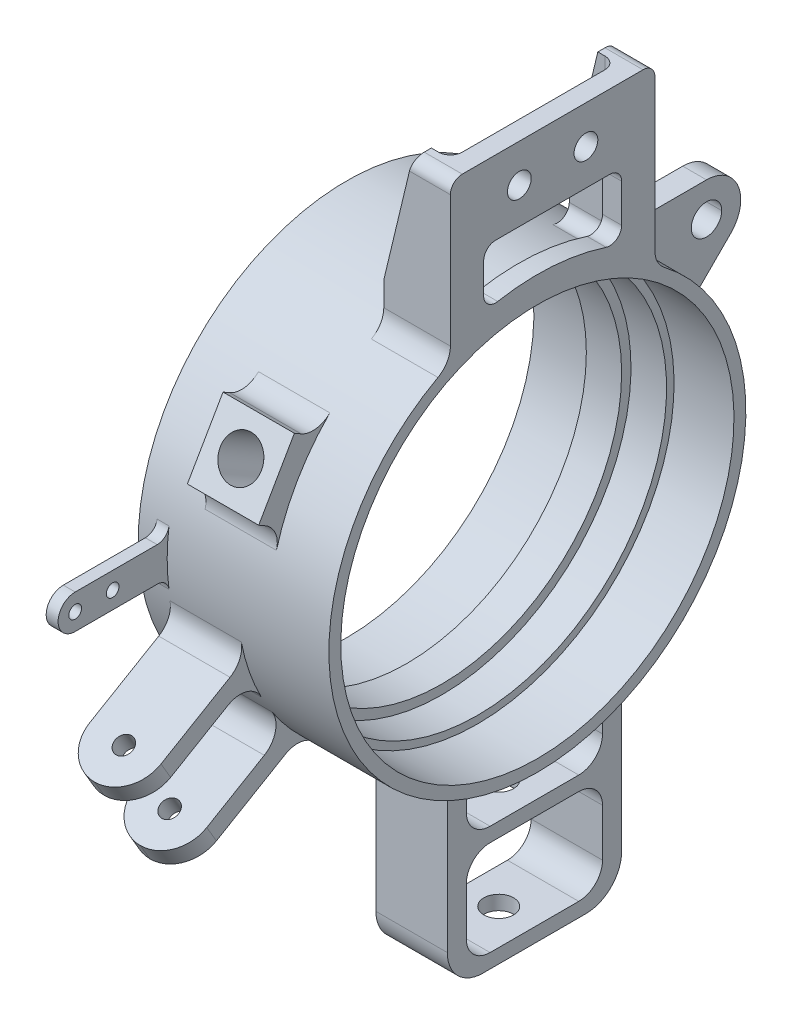
from build123d import *

# Parameters (mm, degrees)
BOSS_EXTRUDE2_DEPTH                  = 37.035000098
BOSS_EXTRUDE2_DIRECTION_2_REACH      = 136.506
BOSS_EXTRUDE2_DIRECTION_2_END_RADIUS = 55.675
SKETCH10_R                           = 4.064
BOSS_EXTRUDE5_DEPTH                  = 6.35
SKETCH12_R                           = 3.175
CUT_EXTRUDE5_DEPTH                   = 129.924460147
BOSS_EXTRUDE7_DEPTH                  = 9.525
BOSS_EXTRUDE7_DEPTH_BACK             = 9.525
CUT_EXTRUDE7_REACH                   = 164.311
SKETCH19_R                           = 5.5
BOSS_EXTRUDE10_REACH                 = 175.333
BOSS_EXTRUDE10_END_RADIUS            = 55.675
SKETCH24_W                           = 19.05
SKETCH24_H                           = 46.533000914
BOSS_EXTRUDE10_DIRECTION_2_DEPTH     = 53.34
CUT_EXTRUDE12_REACH                  = 138.628
SKETCH29_W                           = 36.373000914
SKETCH29_H                           = 25.4
CUT_EXTRUDE11_REACH                  = 222.725
SKETCH26_R                           = 3.96875
CUT_EXTRUDE13_DEPTH                  = 155.515038009
CUT_EXTRUDE14_REACH                  = 143.105
SKETCH32_R                           = 1.7
BOSS_EXTRUDE11_DEPTH                 = 3.175
BOSS_EXTRUDE12_DEPTH                 = 9.525
BOSS_EXTRUDE12_DEPTH_BACK            = 9.525
CUT_EXTRUDE15_REACH                  = 156.791
SKETCH35_R                           = 2.38125
F_0_125_FILLETS_R                    = 3.175
F_0_375_FILLETS_R                    = 9.525
FILLET1_R                            = 6.35


with BuildPart() as part:
    # Sketch1 → Revolve1 (revolve)
    with BuildSketch(Plane.XY, mode=Mode.PRIVATE) as revolve1_sk:
        Polygon((50.925, 52.5), (34.925, 52.5), (34.925, 50.5), (25.425, 50.5), (25.425, 48), (16, 48), (16, 50), (0, 50), (0, 55.675), (50.925, 55.675), align=None)
    revolve(revolve1_sk.sketch.rotate(Axis((50.925, 0, 0), (-1, 0, 0)), 180), axis=Axis((50.925, 0, 0), (-1, 0, 0)))

    # Sketch4 → Boss-Extrude2 (add)
    with BuildSketch(Plane(origin=(0, 55.675, 0), x_dir=(1, 0, 0), z_dir=(0, 1, 0))):
        Polygon((45.845, 26.299476992), (45.845, -18.150523008), (33.145, -18.150523008), (33.145, -23.230523008), (50.925, -23.230523008), (50.925, 31.379476992), (33.145, 31.379476992), (33.145, 26.299476992), align=None)
    extrude(amount=BOSS_EXTRUDE2_DEPTH)

    # Boss-Extrude2 direction 2: up to this cylinder (the profile starts outside it)
    boss_extrude2_direction_2_end = Plane(origin=(46.419315, 0, 0), z_dir=(-1, 0, 0)) * Cylinder(BOSS_EXTRUDE2_DIRECTION_2_END_RADIUS, 385.362, mode=Mode.PRIVATE)
    # Sketch4 → Boss-Extrude2 direction 2 (add, up to the surface)
    with BuildSketch(Plane(origin=(0, 55.675, 0), x_dir=(1, 0, 0), z_dir=(0, 1, 0)), mode=Mode.PRIVATE) as boss_extrude2_direction_2_sk1:
        Polygon((45.845, 26.299476992), (45.845, -18.150523008), (33.145, -18.150523008), (33.145, -23.230523008), (50.925, -23.230523008), (50.925, 31.379476992), (33.145, 31.379476992), (33.145, 26.299476992), align=None)
    boss_extrude2_direction_2_tool1 = extrude(boss_extrude2_direction_2_sk1.sketch, amount=-BOSS_EXTRUDE2_DIRECTION_2_REACH, mode=Mode.PRIVATE) - boss_extrude2_direction_2_end
    add(boss_extrude2_direction_2_tool1.solids().sort_by_distance((46.419315, 55.675, -4.074477))[0])
    add(boss_extrude2_direction_2_tool1.solids().sort_by_distance((46.419315, 55.675, -4.074477))[1])

    # Sketch10 → Boss-Extrude5 (add)
    # profile 1 of 2: a face of its own
    with BuildSketch(Plane.ZY.offset(-31.5204)):
        with BuildLine():
            Line((-64.565, 39.37), (-39.36634, 39.37))
            ThreePointArc((-39.36634, 39.37), (-49.811855399, 24.869352358), (-55.12501584, 7.806295771))
            Line((-55.12501584, 7.806295771), (-71.040546107, 23.769992053))
            ThreePointArc((-71.040546107, 23.769992053), (-73.01030854, 33.731638268), (-64.565, 39.37))
        make_face()
        with Locations((-64.565, 30.226)):
            Circle(SKETCH10_R, mode=Mode.SUBTRACT)
    # profile 2 of 2: a face of its own
    with BuildSketch(Plane.ZY.offset(-31.5204)):
        with BuildLine():
            Line((-62.9635572, -39.228672767), (-42.774784878, -35.637387722))
            ThreePointArc((-42.774784878, -35.637387722), (-50.889440604, -22.582525547), (-55.12501584, -7.806295771))
            Line((-55.12501584, -7.806295771), (-71.040546107, -23.769992053))
            ThreePointArc((-71.040546107, -23.769992053), (-72.669438483, -34.460479056), (-62.9635572, -39.228672767))
        make_face()
        with Locations((-64.565, -30.226)):
            Circle(SKETCH10_R, mode=Mode.SUBTRACT)
    extrude(amount=BOSS_EXTRUDE5_DEPTH)

    # Sketch12 → Cut-Extrude5 (cut, through all)
    with BuildSketch(Plane(origin=(50.925, 0, 0), x_dir=(0, 0, -1), z_dir=(1, 0, 0))):
        with Locations((-4.815523008, 82.550000098)):
            Circle(SKETCH12_R)
        with Locations((12.964476992, 82.550000098)):
            Circle(SKETCH12_R)
    extrude(amount=-CUT_EXTRUDE5_DEPTH, mode=Mode.SUBTRACT)

    # Sketch18 → Boss-Extrude7 (add, two sides: drawn at the far end of the back side and taken through both)
    with BuildSketch(Plane.ZY.offset(-25.4625).offset(-BOSS_EXTRUDE7_DEPTH_BACK)):
        with BuildLine():
            Line((48.95272567, 39.261391971), (58.47772567, 22.763608029))
            Line((58.47772567, 22.763608029), (52.267604989, 19.178193182))
            ThreePointArc((52.267604989, 19.178193182), (48.215964356, 27.8375), (42.742604989, 35.675977124))
            Line((42.742604989, 35.675977124), (48.95272567, 39.261391971))
        make_face()
    extrude(amount=BOSS_EXTRUDE7_DEPTH + BOSS_EXTRUDE7_DEPTH_BACK)

    # Sketch19 → Cut-Extrude7 (cut, up to next)
    with BuildSketch(Plane(origin=(0, 31.0125, 53.71522567), x_dir=(1, 0, 0), z_dir=(0, 0.5000000000000013, 0.8660254037844379)), mode=Mode.PRIVATE) as cut_extrude7_sk1:
        with Locations(Location((25.4625, 0, 0), (0, 0, 270))):
            Circle(SKETCH19_R)
    cut_extrude7_tool1 = extrude(cut_extrude7_sk1.sketch, amount=-CUT_EXTRUDE7_REACH, mode=Mode.PRIVATE) & part.part
    add(cut_extrude7_tool1.solids().sort_by_distance((25.4625, 31.0125, 53.715226))[0], mode=Mode.SUBTRACT)

    # Boss-Extrude10: up to this cylinder (the profile starts outside it)
    boss_extrude10_end = Plane(origin=(27.217303, 0, 0), z_dir=(-1, 0, 0)) * Cylinder(BOSS_EXTRUDE10_END_RADIUS, 463.016, mode=Mode.PRIVATE)
    # Sketch24 → Boss-Extrude10 (add, up to the surface)
    with BuildSketch(Plane(origin=(0, -55.675, 0), x_dir=(-1, 0, 0), z_dir=(0, -1, 0)), mode=Mode.PRIVATE) as boss_extrude10_sk1:
        with Locations((-27.217302944, 13.392580276)):
            Rectangle(SKETCH24_W, SKETCH24_H)
    boss_extrude10_tool1 = extrude(boss_extrude10_sk1.sketch, amount=-BOSS_EXTRUDE10_REACH, mode=Mode.PRIVATE) - boss_extrude10_end
    add(boss_extrude10_tool1.solids().sort_by_distance((27.217303, -55.675, -13.39258))[0])
    add(boss_extrude10_tool1.solids().sort_by_distance((27.217303, -55.675, -13.39258))[1])

    # Sketch24 → Boss-Extrude10 direction 2 (add)
    with BuildSketch(Plane(origin=(0, -55.675, 0), x_dir=(-1, 0, 0), z_dir=(0, -1, 0))):
        with Locations((-27.217302944, 13.392580276)):
            Rectangle(SKETCH24_W, SKETCH24_H)
    extrude(amount=BOSS_EXTRUDE10_DIRECTION_2_DEPTH)

    # Sketch29 → Cut-Extrude12 (cut, up to next)
    with BuildSketch(Plane(origin=(36.742302944, 0, 0), x_dir=(0, 0, -1), z_dir=(1, 0, 0)), mode=Mode.PRIVATE) as cut_extrude12_sk1:
        with Locations((13.392580276, -92.505)):
            Rectangle(SKETCH29_W, SKETCH29_H)
    cut_extrude12_tool1 = extrude(cut_extrude12_sk1.sketch, amount=-CUT_EXTRUDE12_REACH, mode=Mode.PRIVATE) & part.part
    # Sketch29 → Cut-Extrude12 (cut, up to next)
    with BuildSketch(Plane(origin=(36.742302944, 0, 0), x_dir=(0, 0, -1), z_dir=(1, 0, 0)), mode=Mode.PRIVATE) as cut_extrude12_sk2:
        with BuildLine():
            Line((-4.793920181, -58.654418668), (-4.793920181, -75.995))
            Line((-4.793920181, -75.995), (31.579080733, -75.995))
            Line((31.579080733, -75.995), (31.579080733, -49.659683447))
            ThreePointArc((31.579080733, -49.659683447), (14.127544793, -57.129107976), (-4.793920181, -58.654418668))
        make_face()
    cut_extrude12_tool2 = extrude(cut_extrude12_sk2.sketch, amount=-CUT_EXTRUDE12_REACH, mode=Mode.PRIVATE) & part.part
    add(cut_extrude12_tool1.solids().sort_by_distance((36.742303, -92.505, -13.39258))[0], mode=Mode.SUBTRACT)
    add(cut_extrude12_tool2.solids().sort_by_distance((36.742303, -65.94755, -14.743254))[0], mode=Mode.SUBTRACT)

    # Cut-Extrude11: up to this face of the body (flat: up to its plane)
    cut_extrude11_end = Plane(part.part.faces().sort_by_distance((27.217302944, -75.995, -13.392580276))[0])
    # Sketch26 → Cut-Extrude11 (cut, up to the picked face)
    with BuildSketch(Plane.XZ.offset(109.015), mode=Mode.PRIVATE) as cut_extrude11_sk1:
        with Locations(Location((27.217302944, -13.392580276, 0), (0, 0, 270))):
            Circle(SKETCH26_R)
    cut_extrude11_tool1 = split(extrude(cut_extrude11_sk1.sketch, amount=-CUT_EXTRUDE11_REACH, mode=Mode.PRIVATE), bisect_by=cut_extrude11_end, keep=Keep.BOTH, mode=Mode.PRIVATE)
    add(cut_extrude11_tool1.solids().sort_by(Axis((27.217303, -109.015, -13.39258), (0, 1, 0)))[0], mode=Mode.SUBTRACT)

    # Sketch30 → Cut-Extrude13 (cut, through all)
    with BuildSketch(Plane.XY.offset(23.230523008)):
        Polygon((33.145, 92.710000098), (33.145, 60.960000098), (40.765, 92.710000098), align=None)
    extrude(amount=-CUT_EXTRUDE13_DEPTH, mode=Mode.SUBTRACT)

    # Sketch21 → Cut-Extrude14 (cut, up to next)
    with BuildSketch(Plane(origin=(50.925, 0, 0), x_dir=(0, 0, -1), z_dir=(1, 0, 0)), mode=Mode.PRIVATE) as cut_extrude14_sk1:
        with BuildLine():
            Line((-14.340523008, 61.657170678), (-14.340523008, 69.795534597))
            ThreePointArc((-14.340523008, 69.795534597), (-13.410587038, 72.040598627), (-11.165523008, 72.970534597))
            Line((-11.165523008, 72.970534597), (19.314476992, 72.970534597))
            ThreePointArc((19.314476992, 72.970534597), (21.559541022, 72.040598627), (22.489476992, 69.795534597))
            Line((22.489476992, 69.795534597), (22.489476992, 59.608947135))
            ThreePointArc((22.489476992, 59.608947135), (21.181740717, 57.041078139), (18.335806956, 56.58854485))
            ThreePointArc((18.335806956, 56.58854485), (3.988333746, 59.351145052), (-10.599762785, 58.532984324))
            ThreePointArc((-10.599762785, 58.532984324), (-13.200754726, 59.220275757), (-14.340523008, 61.657170678))
        make_face()
    cut_extrude14_tool1 = extrude(cut_extrude14_sk1.sketch, amount=-CUT_EXTRUDE14_REACH, mode=Mode.PRIVATE) & part.part
    add(cut_extrude14_tool1.solids().sort_by_distance((50.925, 65.695583, -4.596287))[0], mode=Mode.SUBTRACT)

    # Sketch32 → Boss-Extrude11 (add)
    with BuildSketch(Plane(origin=(7.745, 0, 0), x_dir=(0, 0, -1), z_dir=(1, 0, 0))):
        with BuildLine():
            Line((-80.233, -4.572), (-55.486957395, -4.572))
            ThreePointArc((-55.486957395, -4.572), (-55.675, 0), (-55.486957395, 4.572))
            Line((-55.486957395, 4.572), (-80.233, 4.572))
            ThreePointArc((-80.233, 4.572), (-84.805, 0), (-80.233, -4.572))
        make_face()
        with Locations(Location((-80.233, 0, 0), (0, 0, 90))):
            Circle(SKETCH32_R, mode=Mode.SUBTRACT)
        with Locations(Location((-70.233, 0, 0), (0, 0, 90))):
            Circle(SKETCH32_R, mode=Mode.SUBTRACT)
    extrude(amount=-BOSS_EXTRUDE11_DEPTH)

    # Sketch34 → Boss-Extrude12 (add, two sides: drawn at the far end of the back side and taken through both)
    with BuildSketch(Plane.ZY.offset(-17.057302944).offset(-BOSS_EXTRUDE12_DEPTH_BACK)):
        with BuildLine():
            Line((81.803608836, -37.023590793), (52.118649164, -19.579377781))
            ThreePointArc((52.118649164, -19.579377781), (52.976741153, -17.12222304), (53.719060598, -14.627650307))
            Line((53.719060598, -14.627650307), (84.377349539, -32.64383523))
            Line((84.377349539, -32.64383523), (81.803608836, -37.023590793))
        make_face()
        with BuildLine():
            Line((72.152081198, -53.447674155), (42.467121527, -36.003461142))
            ThreePointArc((42.467121527, -36.003461142), (40.738099975, -37.94881863), (38.920051553, -39.811244794))
            Line((38.920051553, -39.811244794), (69.578340495, -57.827429718))
            Line((69.578340495, -57.827429718), (72.152081198, -53.447674155))
        make_face()
    extrude(amount=BOSS_EXTRUDE12_DEPTH + BOSS_EXTRUDE12_DEPTH_BACK)

    # Cut-Extrude15: up to this face of the body (flat: up to its plane)
    cut_extrude15_end = Plane(part.part.faces().sort_by_distance((17.057302944, -48.819337256, 54.249196024))[0])
    # Sketch35 → Cut-Extrude15 (cut, up to the picked face)
    with BuildSketch(Plane(origin=(0, 12.591797244, 7.399504522), x_dir=(1, 0, 0), z_dir=(0, 0.8621566068970934, 0.5066418707368066)), mode=Mode.PRIVATE) as cut_extrude15_sk1:
        with Locations(Location((17.057302944, -80.214451958, 0), (0, 0, 270))):
            Circle(SKETCH35_R)
    cut_extrude15_tool1 = split(extrude(cut_extrude15_sk1.sketch, amount=-CUT_EXTRUDE15_REACH, mode=Mode.PRIVATE), bisect_by=cut_extrude15_end, keep=Keep.BOTH, mode=Mode.PRIVATE)
    add(cut_extrude15_tool1.solids().sort_by(Axis((17.057303, -28.048203, 76.556924), (0, -0.8621566068970934, -0.5066418707368066)))[0], mode=Mode.SUBTRACT)

    # 0.125" fillets
    f_0_125_fillets_edges = [part.edges().sort_by_distance(p)[0] for p in [
        (45.845, 92.710000098, 23.230523008),
        (6.1575, 4.572, 55.486957395),
        (6.1575, -4.572, 55.486957395),
        (39.495, 49.071816096, -26.299476992),
        (45.845, 70.890908097, -26.299476992),
        (45.845, 55.497146076, -4.446616969),
        (45.845, 72.671649435, 18.150523008),
        (39.495, 52.633298771, 18.150523008),
        (45.845, 92.710000098, -31.379476992),
        (28.3454, 7.806295771, -55.12501584),
        (28.3454, 39.37, -39.36634),
        (28.3454, -35.637387722, -42.774784878),
        (28.3454, -7.806295771, -55.12501584),
    ]]
    fillet(f_0_125_fillets_edges, radius=F_0_125_FILLETS_R)

    # 0.375" fillets
    f_0_375_fillets_edges = [part.edges().sort_by_distance(p)[0] for p in [
        (27.217302944, -109.015, -36.659080733),
        (27.217302944, -109.015, 9.873920181),
        (26.582302944, -55.637551936, 70.865210846),
        (7.532302944, -55.637551936, 70.865210846),
        (7.532302944, -34.833713012, 83.090479187),
        (26.582302944, -34.833713012, 83.090479187),
    ]]
    fillet(f_0_375_fillets_edges, radius=F_0_375_FILLETS_R - 0.0001)  # a hair under: the kernel refuses the full size

    # Fillet1
    fillet1_edges = [part.edges().sort_by_distance(p)[0] for p in [
        (27.217302944, -41.902475163, -36.659080733),
        (27.217302944, -54.792438577, 9.873920181),
        (27.217302944, -105.205, 4.793920181),
        (27.217302944, -79.805, 4.793920181),
        (27.217302944, -79.805, -31.579080733),
        (27.217302944, -105.205, -31.579080733),
        (27.217302944, -75.995, -31.579080733),
        (27.217302944, -75.995, 4.793920181),
        (27.217302944, -58.654418668, 4.793920181),
        (27.217302944, -49.659683447, -31.579080733),
        (17.057302944, -19.579377781, 52.118649164),
        (17.057302944, -14.627650307, 53.719060598),
        (17.057302944, -39.811244794, 38.920051553),
        (17.057302944, -36.003461142, 42.467121527),
        (42.035, 50.59692111, 23.230523008),
        (42.035, 45.989499331, -31.379476992),
        (25.4625, 19.178193182, 52.267604989),
        (25.4625, 35.675977124, 42.742604989),
    ]]
    fillet(fillet1_edges, radius=FILLET1_R)


solid = part.part
